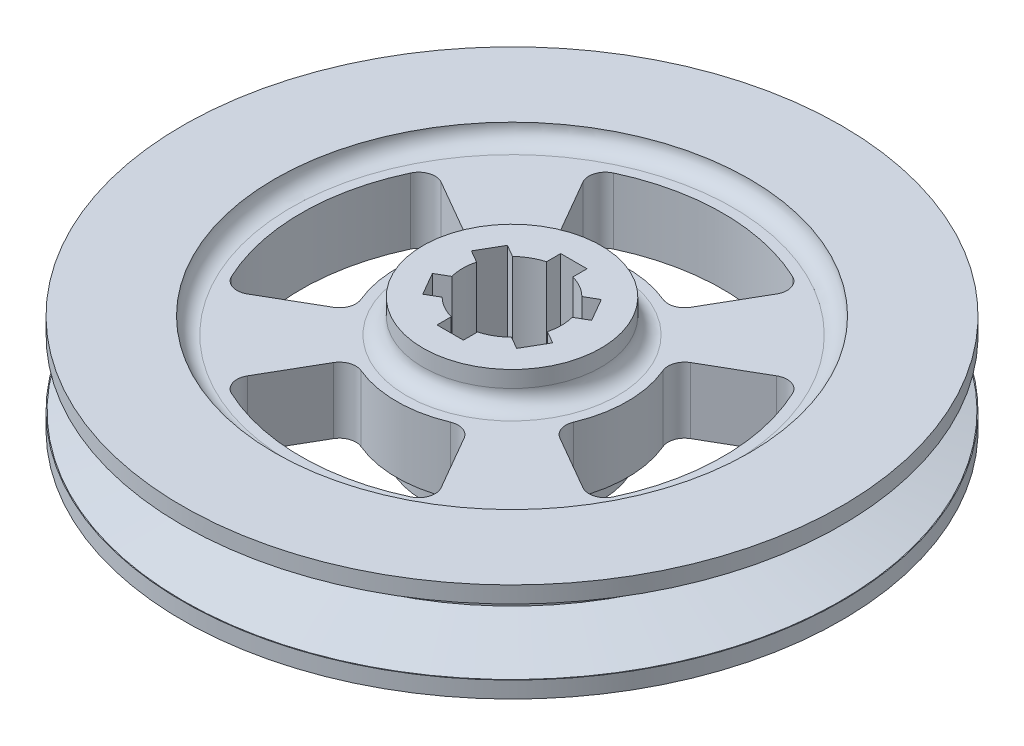
from build123d import *

# Parameters (mm, degrees)
SKETCH1_R                 = 100
BOSS_EXTRUDE1_DEPTH       = 10
BOSS_EXTRUDE3_DEPTH       = 10
BOSS_EXTRUDE3_DEPTH_BACK  = 30
SKETCH2_R                 = 27
SKETCH4_R                 = 27
BOSS_EXTRUDE4_DEPTH       = 5
BOSS_EXTRUDE11_DEPTH      = 5
BOSS_EXTRUDE11_DEPTH_BACK = 25
SKETCH7_R                 = 100
SKETCH7_R_2               = 72
CUT_EXTRUDE1_DEPTH        = 147.969384567
FILLET1_R                 = 5
FILLET2_R                 = 5


with BuildPart() as part:
    # Sketch1 → Boss-Extrude1 (new, symmetric)
    with BuildSketch(Plane(origin=(0, 0, 0), x_dir=(1, 0, 0), z_dir=(0, 1, 0))):
        with Locations(Location((0, 0, 0), (0, 0, 270))):
            Circle(SKETCH1_R)
        with BuildLine():
            Line((-17.5, 30.310889132), (-32, 55.425625842))
            ThreePointArc((-32, 55.425625842), (0, 64), (32, 55.425625842))
            Line((32, 55.425625842), (17.5, 30.310889132))
            ThreePointArc((17.5, 30.310889132), (0, 35), (-17.5, 30.310889132))
        make_face(mode=Mode.SUBTRACT)
        with BuildLine():
            Line((30.310889132, 17.5), (55.425625842, 32))
            ThreePointArc((55.425625842, 32), (64, 0), (55.425625842, -32))
            Line((55.425625842, -32), (30.310889132, -17.5))
            ThreePointArc((30.310889132, -17.5), (35, 0), (30.310889132, 17.5))
        make_face(mode=Mode.SUBTRACT)
        with BuildLine():
            Line((17.5, -30.310889132), (32, -55.425625842))
            ThreePointArc((32, -55.425625842), (0, -64), (-32, -55.425625842))
            Line((-32, -55.425625842), (-17.5, -30.310889132))
            ThreePointArc((-17.5, -30.310889132), (0, -35), (17.5, -30.310889132))
        make_face(mode=Mode.SUBTRACT)
        with BuildLine():
            Line((-30.310889132, -17.5), (-55.425625842, -32))
            ThreePointArc((-55.425625842, -32), (-64, 0), (-55.425625842, 32))
            Line((-55.425625842, 32), (-30.310889132, 17.5))
            ThreePointArc((-30.310889132, 17.5), (-35, 0), (-30.310889132, -17.5))
        make_face(mode=Mode.SUBTRACT)
    extrude(amount=BOSS_EXTRUDE1_DEPTH, both=True)

    # Sketch2 → Boss-Extrude3 (add, two sides: drawn at the far end of the back side and taken through both)
    with BuildSketch(Plane(origin=(0, 10, 0), x_dir=(1, 0, 0), z_dir=(0, 1, 0)).offset(-BOSS_EXTRUDE3_DEPTH_BACK)):
        with Locations(Location((0, 0, 0), (0, 0, 270))):
            Circle(SKETCH2_R)
    extrude(amount=BOSS_EXTRUDE3_DEPTH + BOSS_EXTRUDE3_DEPTH_BACK)

    # Sketch4 → Boss-Extrude4 (add, symmetric)
    with BuildSketch(Plane.XZ.offset(10)):
        with Locations(Location((0, 0, 0), (0, 0, 90))):
            Circle(SKETCH4_R)
    extrude(amount=BOSS_EXTRUDE4_DEPTH, both=True)

    # Sketch7 → Boss-Extrude11 (add, two sides: drawn at the far end of the back side and taken through both)
    with BuildSketch(Plane.XZ.offset(10).offset(-BOSS_EXTRUDE11_DEPTH_BACK)):
        with Locations(Location((0, 0, 0), (0, 0, 270))):
            Circle(SKETCH7_R)
        with Locations(Location((0, 0, 0), (0, 0, 270))):
            Circle(SKETCH7_R_2, mode=Mode.SUBTRACT)
    extrude(amount=BOSS_EXTRUDE11_DEPTH + BOSS_EXTRUDE11_DEPTH_BACK)

    # Sketch8 → Cut-Extrude1 (cut, through all)
    with BuildSketch(Plane(origin=(0, 20, 0), x_dir=(1, 0, 0), z_dir=(0, 1, 0))):
        with BuildLine():
            Line((-4, 14.456832295), (-4, 18.762826765))
            Line((-4, 18.762826765), (4, 18.762826765))
            Line((4, 18.762826765), (4, 14.456832295))
            ThreePointArc((4, 14.456832295), (7.5, 12.990381057), (10.519984026, 10.692517763))
            Line((10.519984026, 10.692517763), (14.249084625, 12.845514997))
            Line((14.249084625, 12.845514997), (18.249084625, 5.917311767))
            Line((18.249084625, 5.917311767), (14.519984026, 3.764314532))
            ThreePointArc((14.519984026, 3.764314532), (15, 0), (14.519984026, -3.764314532))
            Line((14.519984026, -3.764314532), (18.249084625, -5.917311767))
            Line((18.249084625, -5.917311767), (14.249084625, -12.845514997))
            Line((14.249084625, -12.845514997), (10.519984026, -10.692517763))
            ThreePointArc((10.519984026, -10.692517763), (7.5, -12.990381057), (4, -14.456832295))
            Line((4, -14.456832295), (4, -18.762826765))
            Line((4, -18.762826765), (-4, -18.762826765))
            Line((-4, -18.762826765), (-4, -14.456832295))
            ThreePointArc((-4, -14.456832295), (-7.5, -12.990381057), (-10.519984026, -10.692517763))
            Line((-10.519984026, -10.692517763), (-14.249084625, -12.845514997))
            Line((-14.249084625, -12.845514997), (-18.249084625, -5.917311767))
            Line((-18.249084625, -5.917311767), (-14.519984026, -3.764314532))
            ThreePointArc((-14.519984026, -3.764314532), (-15, 0), (-14.519984026, 3.764314532))
            Line((-14.519984026, 3.764314532), (-18.249084625, 5.917311767))
            Line((-18.249084625, 5.917311767), (-14.249084625, 12.845514997))
            Line((-14.249084625, 12.845514997), (-10.519984026, 10.692517763))
            ThreePointArc((-10.519984026, 10.692517763), (-7.5, 12.990381057), (-4, 14.456832295))
        make_face()
    extrude(amount=-CUT_EXTRUDE1_DEPTH, mode=Mode.SUBTRACT)

    # Sketch9 → Cut-Revolve4 (revolve, cut)
    with BuildSketch(Plane(origin=(0, 0, 0), x_dir=(0, 0, -1), z_dir=(1, 0, 0))):
        Polygon((-80, 4.71), (-80, -4.71), (-99.775475202, -10.00882261), (-116.246670556, -10.00882261), (-116.246670556, 9.978109538), (-99.839422916, 9.978109538), (-99.775475202, 10.00882261), align=None)
    revolve(axis=Axis((0, 78.143519102, 0), (0, -1, 0)), mode=Mode.SUBTRACT)

    # Fillet1
    fillet1_edges = [part.edges().sort_by_distance(p)[0] for p in [
        (0, 10, -27),
        (0, -10, -27),
        (0, -10, 72),
        (0, 10, 72),
    ]]
    fillet(fillet1_edges, radius=FILLET1_R - 0.0001)  # a hair under: the kernel refuses the full size

    # Fillet2
    fillet2_edges = [part.edges().sort_by_distance(p)[0] for p in [
        (30.310889132, 0, -17.5),
        (30.310889132, 0, 17.5),
        (55.425625842, 0, 32),
        (55.425625842, 0, -32),
        (17.5, 0, 30.310889132),
        (-17.5, 0, 30.310889132),
        (-32, 0, 55.425625842),
        (32, 0, 55.425625842),
        (-30.310889132, 0, 17.5),
        (-30.310889132, 0, -17.5),
        (-55.425625842, 0, -32),
        (-55.425625842, 0, 32),
        (-17.5, 0, -30.310889132),
        (17.5, 0, -30.310889132),
        (32, 0, -55.425625842),
        (-32, 0, -55.425625842),
    ]]
    fillet(fillet2_edges, radius=FILLET2_R)


solid = part.part
